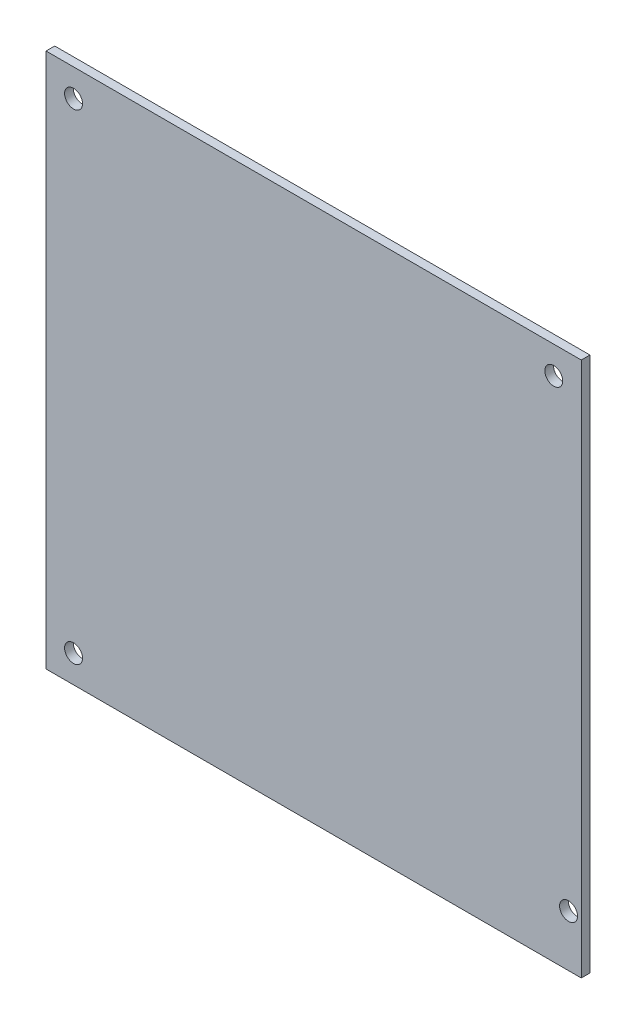
from build123d import *

# Parameters (mm, degrees)
SKETCH1_W                  = 92.5
SKETCH1_H                  = 92.5
BOSS_EXTRUDE1_DEPTH        = 1.5
F_3_1_3_1_DIAMETER_HOLE1_D = 3.1


with BuildPart() as part:
    # Sketch1 → Boss-Extrude1 (new body)
    with BuildSketch(Plane.XY):
        Rectangle(SKETCH1_W, SKETCH1_H)
    extrude(amount=BOSS_EXTRUDE1_DEPTH)

    # Ø3.1 (3.1) Diameter Hole1 (through all)
    with Locations(Plane.XY.offset(1.5)):
        with Locations((-41.5, 41.5), (41.5, 41.5), (44.05, -37.33), (-41.5, -41.5)):
            Hole(F_3_1_3_1_DIAMETER_HOLE1_D / 2)


solid = part.part
